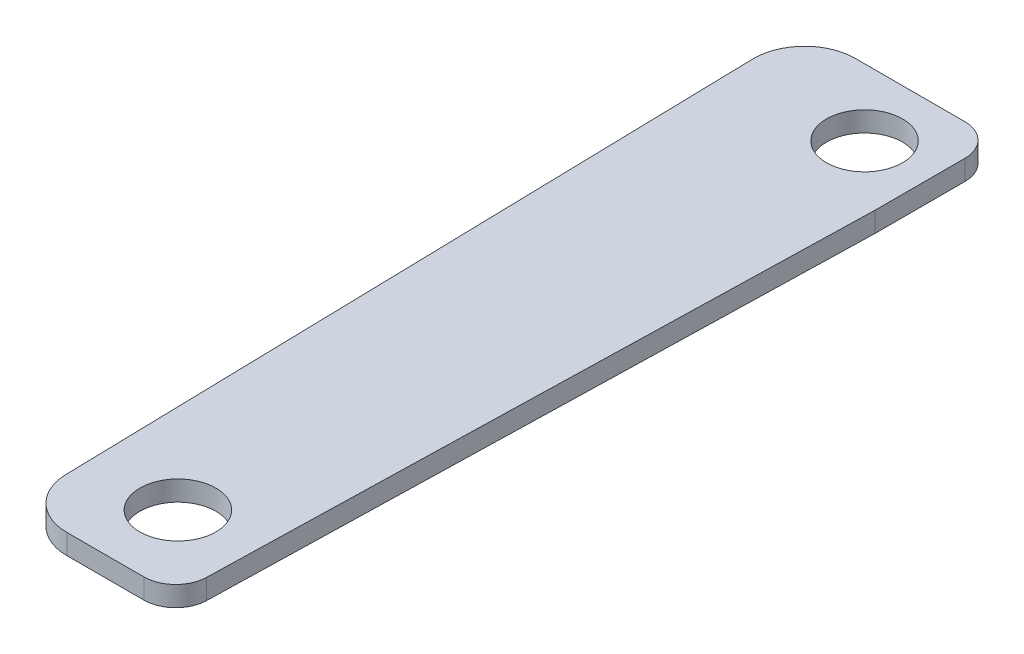
from build123d import *

# Parameters (mm, degrees)
SKETCH1_W           = 38.1
SKETCH1_H           = 127
BOSS_EXTRUDE1_DEPTH = 3.175
SKETCH3_R           = 6
CUT_EXTRUDE1_DEPTH  = 10
CUT_EXTRUDE2_DEPTH  = 10
FILLET2_R           = 5
FILLET3_R           = 8


with BuildPart() as part:
    # Sketch1 → Boss-Extrude1 (new body)
    with BuildSketch(Plane(origin=(0, 0, 0), x_dir=(1, 0, 0), z_dir=(0, 1, 0))):
        with Locations((19.05, 63.5)):
            Rectangle(SKETCH1_W, SKETCH1_H)
    extrude(amount=BOSS_EXTRUDE1_DEPTH)

    # Sketch3 → Cut-Extrude1 (cut)
    with BuildSketch(Plane(origin=(0, 3.175, 0), x_dir=(1, 0, 0), z_dir=(0, 1, 0))):
        with Locations((27.788117097, 116.463824801)):
            Circle(SKETCH3_R)
        with Locations((24.061050734, 11.823957308)):
            Circle(SKETCH3_R)
    extrude(amount=-CUT_EXTRUDE1_DEPTH, mode=Mode.SUBTRACT)

    # Sketch4 → Cut-Extrude2 (cut)
    with BuildSketch(Plane(origin=(0, 3.175, 0), x_dir=(1, 0, 0), z_dir=(0, 1, 0))):
        Polygon((0, 127), (7.592207633, 127), (10.559436461, 0), (33.279939239, 0), (35.412438885, 0), (38.1, 107.822378656), (63.321263008, 4.62642836), (13.31953993, -14.684552237), (-13.258238812, -5.029061939), align=None)
    extrude(amount=-CUT_EXTRUDE2_DEPTH, mode=Mode.SUBTRACT)

    # Fillet2
    fillet2_edges = [part.edges().sort_by_distance(p)[0] for p in [
        (38.1, 1.5875, -127),
        (35.412438885, 1.5875, 0),
    ]]
    fillet(fillet2_edges, radius=FILLET2_R)

    # Fillet3
    fillet3_edges = [part.edges().sort_by_distance(p)[0] for p in [
        (10.559436461, 1.5875, 0),
        (7.592207633, 1.5875, -127),
    ]]
    fillet(fillet3_edges, radius=FILLET3_R)


solid = part.part
